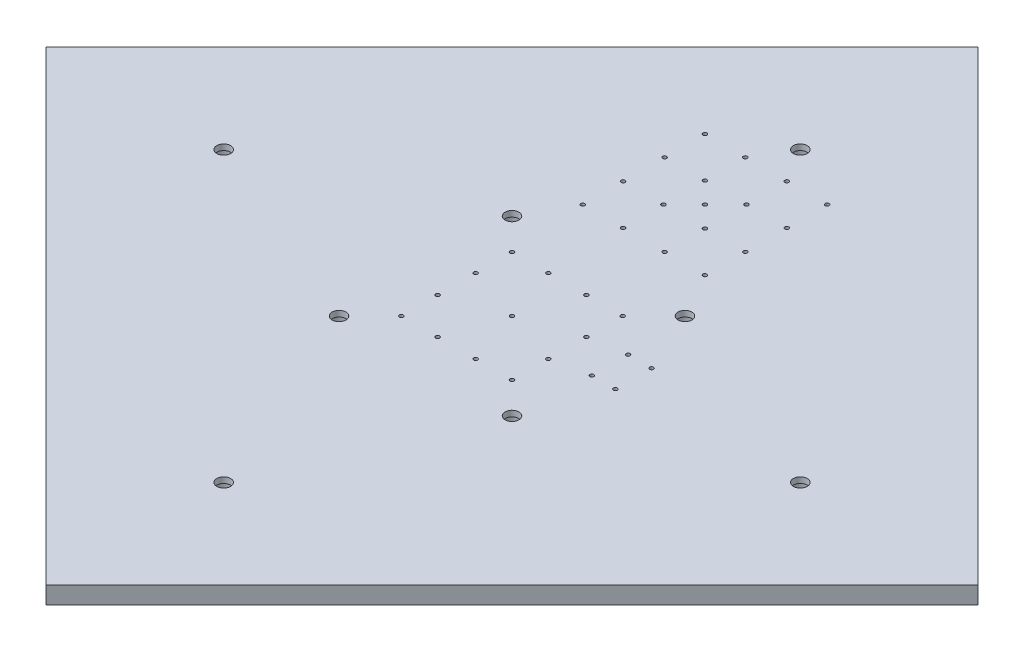
from build123d import *

# Parameters (mm, degrees)
BOSS_EXTRUDE1_DEPTH             = 15
CBORE_FOR_M10_SHCS1_D           = 12
CBORE_FOR_M10_SHCS1_CBORE_D     = 18
CBORE_FOR_M10_SHCS1_CBORE_DEPTH = 10
CBORE_FOR_M3_SHCS1_D            = 3.4
CBORE_FOR_M3_SHCS1_CBORE_D      = 6.5
CBORE_FOR_M3_SHCS1_CBORE_DEPTH  = 4
CBORE_FOR_M3_SHCS2_D            = 3.4
CBORE_FOR_M3_SHCS2_CBORE_D      = 6.5
CBORE_FOR_M3_SHCS2_CBORE_DEPTH  = 4


with BuildPart() as part:
    # Sketch1 → Boss-Extrude1 (new body)
    with BuildSketch(Plane(origin=(0, 0, 0), x_dir=(1, 0, 0), z_dir=(0, 1, 0))):
        Polygon((-404.111525448, 0), (0, 404.111525448), (404.111525448, 0), (0, -404.111525448), align=None)
    extrude(amount=BOSS_EXTRUDE1_DEPTH)

    # CBORE for M10 SHCS1 (through all)
    with Locations(Plane.XZ):
        with Locations((75, 75), (0, -250), (250, 0), (0, 250), (-250, 0), (75, -75), (-75, -75), (-75, 75)):
            CounterBoreHole(CBORE_FOR_M10_SHCS1_D / 2, CBORE_FOR_M10_SHCS1_CBORE_D / 2, CBORE_FOR_M10_SHCS1_CBORE_DEPTH)

    # CBORE for M3 SHCS1 (through all)
    with Locations(Plane(origin=(0, 0, 0), x_dir=(-1, 0, 0), z_dir=(0, -1, 0))):
        with Locations((0, 0), (-48, -48), (16.5, -48), (-16.5, -48), (48, -48), (48, -16.5), (48, 16.5), (48, 48), (16.5, 48), (-16.5, 48), (-48, 48), (-79.35, -10.1), (-99.7, -10.1), (-99.7, 21.3), (-79.35, 21.3), (-48, -16.5), (-48, 16.5)):
            CounterBoreHole(CBORE_FOR_M3_SHCS1_D / 2, CBORE_FOR_M3_SHCS1_CBORE_D / 2, CBORE_FOR_M3_SHCS1_CBORE_DEPTH)

    # CBORE for M3 SHCS2 (through all)
    with Locations(Plane(origin=(0, 0, 0), x_dir=(-1, 0, 0), z_dir=(0, -1, 0))):
        with Locations((0, 167.320913922), (53, 114.320913922), (53, 149.320913922), (53, 185.320913922), (53, 220.320913922), (18, 220.320913922), (-18, 220.320913922), (-53, 220.320913922), (-53, 185.320913922), (-53, 149.320913922), (-53, 114.320913922), (-18, 114.320913922), (18, 114.320913922), (18, 149.320913922), (18, 185.320913922), (-18, 149.320913922), (-18, 185.320913922)):
            CounterBoreHole(CBORE_FOR_M3_SHCS2_D / 2, CBORE_FOR_M3_SHCS2_CBORE_D / 2, CBORE_FOR_M3_SHCS2_CBORE_DEPTH)


solid = part.part
